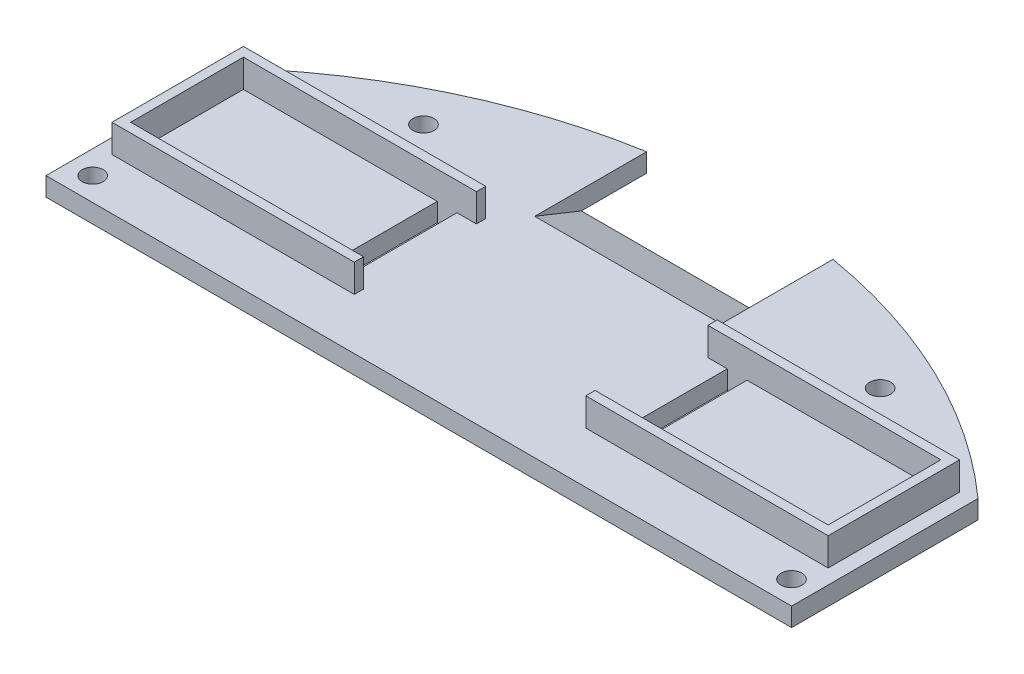
from build123d import *

# Parameters (mm, degrees)
SKETCH2_R           = 1.125
SKETCH2_W           = 2.12
SKETCH2_H           = 12.1
BOSS_EXTRUDE2_DEPTH = 2
BOSS_EXTRUDE3_DEPTH = 3
CHAMFER1_SIZE2      = 2
CHAMFER1_SIZE       = 5


with BuildPart() as part:
    # Sketch2 → Boss-Extrude2 (new body)
    with BuildSketch(Plane(origin=(0, 0, 0), x_dir=(1, 0, 0), z_dir=(0, 1, 0))):
        with BuildLine():
            Line((-10, 24.439438281), (-10, 17.439438281))
            Line((-10, 17.439438281), (10, 17.439438281))
            Line((10, 17.439438281), (10, 24.439438281))
            ThreePointArc((10, 24.439438281), (26.021613026, 19.342266443), (40, 10))
            Line((40, 10), (40, -10))
            Line((40, -10), (-40, -10))
            Line((-40, -10), (-40, 10))
            ThreePointArc((-40, 10), (-26.021613026, 19.342266443), (-10, 24.439438281))
        make_face()
        with Locations(Location((-37.490381057, -7.5, 0), (0, 0, 270))):
            Circle(SKETCH2_R, mode=Mode.SUBTRACT)
        with Locations(Location((37.490381057, -7.5, 0), (0, 0, 90))):
            Circle(SKETCH2_R, mode=Mode.SUBTRACT)
        with Locations(Location((-24.5, 15, 0), (0, 0, 270))):
            Circle(SKETCH2_R, mode=Mode.SUBTRACT)
        with Locations(Location((24.5, 15, 0), (0, 0, 90))):
            Circle(SKETCH2_R, mode=Mode.SUBTRACT)
        with Locations((15.56, 2.55)):
            Rectangle(SKETCH2_W, SKETCH2_H, mode=Mode.SUBTRACT)
        with Locations((-15.56, 2.55)):
            Rectangle(SKETCH2_W, SKETCH2_H, mode=Mode.SUBTRACT)
    extrude(amount=BOSS_EXTRUDE2_DEPTH)

    # Sketch3 → Boss-Extrude3 (add)
    with BuildSketch(Plane(origin=(0, 2, 0), x_dir=(1, 0, 0), z_dir=(0, 1, 0))):
        Polygon((12.419999998, -3.5), (37.42, -3.5), (37.42, 8.6), (12.419999998, 8.6), (12.419999998, 9.599999996), (38.419999998, 9.599999996), (38.419999998, -4.499999996), (12.419999998, -4.499999996), align=None)
        Polygon((-12.419999998, -3.5), (-12.419999998, -4.499999996), (-38.419999998, -4.499999996), (-38.419999998, 9.599999996), (-12.419999998, 9.599999996), (-12.419999998, 8.6), (-37.42, 8.6), (-37.42, -3.5), align=None)
    extrude(amount=BOSS_EXTRUDE3_DEPTH)

    # Chamfer1
    chamfer1_edges = [part.edges().sort_by_distance(p)[0] for p in [
        (0, 2, -17.439438281),
    ]]
    chamfer1_side = [part.faces().sort_by_distance(p)[0] for p in [
        (0, 2, -17.399438281),
    ]]
    chamfer(chamfer1_edges, length=CHAMFER1_SIZE - 0.0001, length2=CHAMFER1_SIZE2 - 0.0001, reference=chamfer1_side[0])  # a hair under: the kernel refuses the full size


solid = part.part
